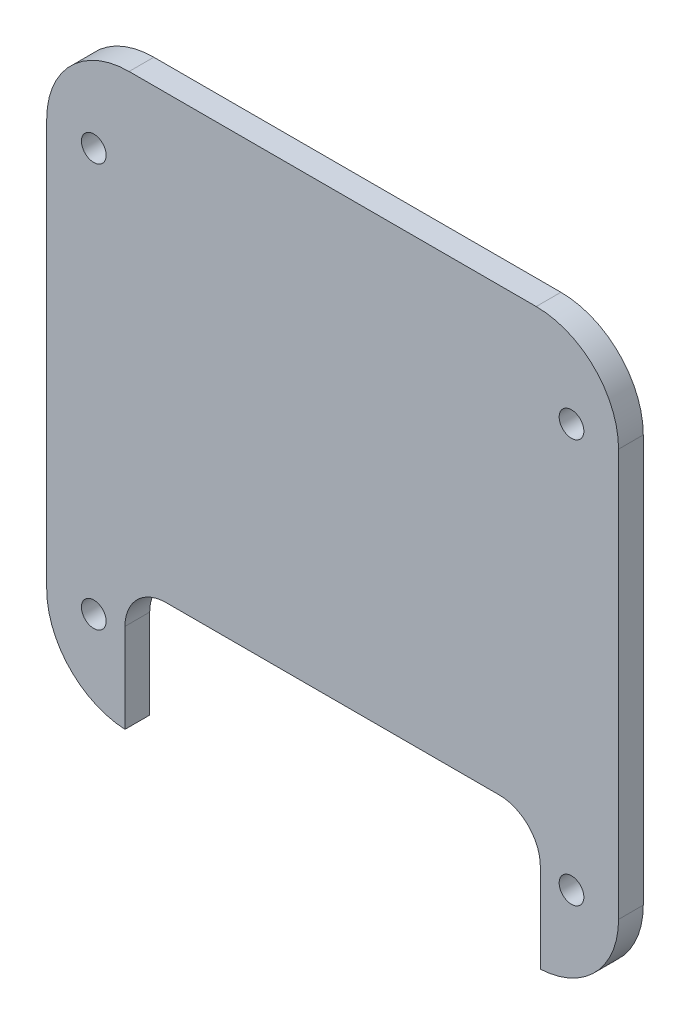
from build123d import *

# Parameters (mm, degrees)
SKETCH1_W           = 69.43077851
SKETCH1_H           = 69.43077851
BOSS_EXTRUDE2_DEPTH = 3
SKETCH6_R           = 1.5
SKETCH6_W           = 50.43077851
SKETCH6_H           = 15.826208999
CUT_EXTRUDE1_DEPTH  = 10
FILLET1_R           = 10
FILLET2_R           = 10
FILLET3_R           = 4.994579941


with BuildPart() as part:
    # Sketch1 → Boss-Extrude2 (new body)
    with BuildSketch(Plane.XY):
        Rectangle(SKETCH1_W, SKETCH1_H)
    extrude(amount=BOSS_EXTRUDE2_DEPTH)

    # Sketch6 → Cut-Extrude1 (cut)
    with BuildSketch(Plane.XY.offset(3)):
        with Locations((-29, 24.5)):
            Circle(SKETCH6_R)
        with Locations((-29, -24.5)):
            Circle(SKETCH6_R)
        with Locations((29, -24.5)):
            Circle(SKETCH6_R)
        with Locations((29, 24.5)):
            Circle(SKETCH6_R)
        with Locations((0, -26.802284756)):
            Rectangle(SKETCH6_W, SKETCH6_H)
    extrude(amount=-CUT_EXTRUDE1_DEPTH, mode=Mode.SUBTRACT)

    # Fillet1
    fillet1_edges = [part.edges().sort_by_distance(p)[0] for p in [
        (34.715389255, 34.715389255, 1.5),
    ]]
    fillet(fillet1_edges, radius=FILLET1_R)

    # Fillet2
    # the kernel refuses this fillet: 10 mm, written as the material it takes off along each edge
    with BuildSketch(Plane(origin=(34.715389255, -34.715389255, -24.968730444), x_dir=(0, 1, 0), z_dir=(0, 0, 1))) as fillet2_piece_1:
        with BuildLine():
            CenterArc((9.987492178, 10), FILLET2_R, 182.865983983, 87.134016017)
            Line((0, 9.5), (-0.199749844, 9.49))
            ThreePointArc((-0.199749844, 9.49), (-0.2, 4.75), (-0.2, 0))
            Line((-0.2, 0), (0, -0.2))
            Line((0, -0.2), (9.987492178, -0.2))
            Line((9.987492178, -0.2), (9.987492178, 0))
        make_face()
    extrude(amount=52.937460889, mode=Mode.SUBTRACT)
    with BuildSketch(Plane(origin=(-34.715389255, -34.715389255, -24.968730444), x_dir=(0, 1, 0), z_dir=(0, 0, 1))) as fillet2_piece_2:
        with BuildLine():
            CenterArc((9.987492178, -10), FILLET2_R, 90, 87.134016017)
            Line((0, -9.5), (-0.199749844, -9.49))
            ThreePointArc((-0.199749844, -9.49), (-0.2, -4.75), (-0.2, 0))
            Line((-0.2, 0), (0, 0.2))
            Line((0, 0.2), (9.987492178, 0.2))
            Line((9.987492178, 0.2), (9.987492178, 0))
        make_face()
    extrude(amount=52.937460889, mode=Mode.SUBTRACT)
    with BuildSketch(Plane(origin=(-34.715389255, 34.715389255, -25), x_dir=(1, 0, 0), z_dir=(0, 0, 1))) as fillet2_piece_3:
        with BuildLine():
            CenterArc((FILLET2_R, -FILLET2_R), FILLET2_R, 90, 90)
            Line((0, -FILLET2_R), (-FILLET2_R * 0.02, -FILLET2_R))
            Line((-FILLET2_R * 0.02, -FILLET2_R), (-FILLET2_R * 0.02, FILLET2_R * 0.02))
            Line((-FILLET2_R * 0.02, FILLET2_R * 0.02), (FILLET2_R, FILLET2_R * 0.02))
            Line((FILLET2_R, FILLET2_R * 0.02), (FILLET2_R, 0))
        make_face()
    extrude(amount=53, mode=Mode.SUBTRACT)

    # Fillet3
    fillet3_edges = [part.edges().sort_by_distance(p)[0] for p in [
        (-25.215389255, -18.889180256, 1.5),
        (25.215389255, -18.889180256, 1.5),
    ]]
    fillet(fillet3_edges, radius=FILLET3_R)


solid = part.part
